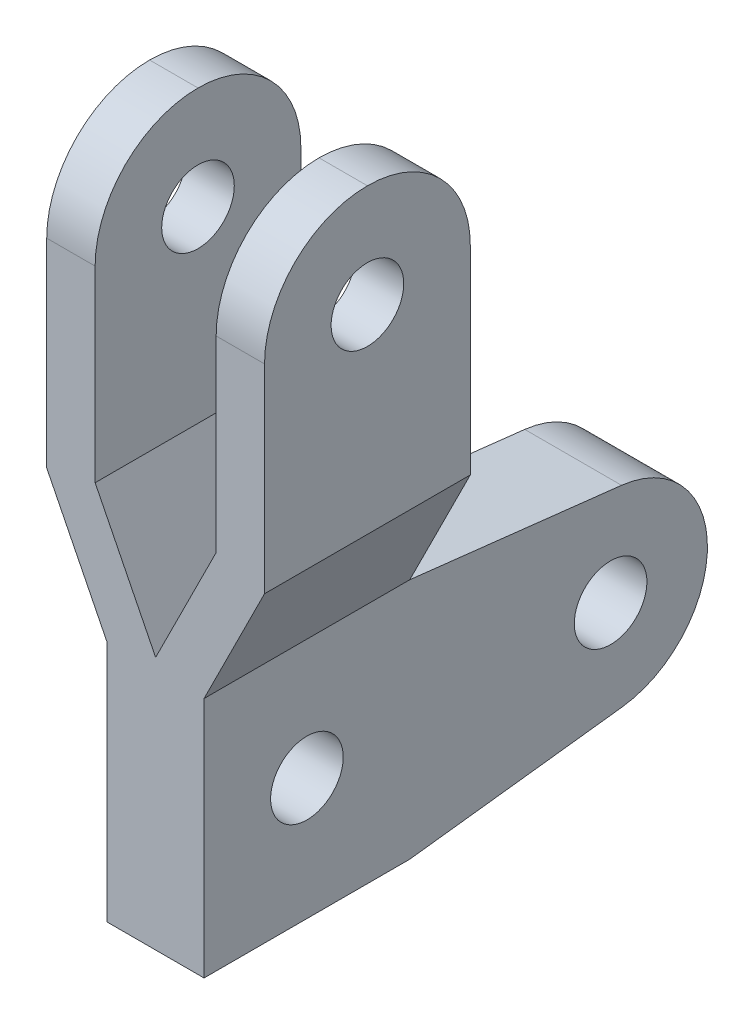
from build123d import *

# Parameters (mm, degrees)
BASE_EXTRUDE_DEPTH  = 10.795
SKETCH2_R           = 1.905
CUT_EXTRUDE1_DEPTH  = 36.062279171
FILLET1_R           = 5.3975
SKETCH3_R           = 1.905
CUT_EXTRUDE2_DEPTH  = 35.159384445
BOSS_EXTRUDE1_START = -5.08
SKETCH4_R           = 1.905
BOSS_EXTRUDE1_DEPTH = 5.08


with BuildPart() as part:
    # Sketch1 → Base-Extrude (new body)
    with BuildSketch(Plane.XY):
        Polygon((-3.175, 3.549757914), (-5.715, 3.549757914), (-5.715, -12.289854749), (-2.54, -18.639854749), (-2.54, -31.339854749), (2.54, -31.339854749), (2.54, -18.639854749), (5.715, -12.289854749), (5.715, 3.549757914), (3.175, 3.549757914), (3.175, -11.690242086), (0, -18.040242086), (-3.175, -11.690242086), align=None)
    extrude(amount=BASE_EXTRUDE_DEPTH)

    # Sketch2 → Cut-Extrude1 (cut, through all)
    with BuildSketch(Plane(origin=(5.715, 0, 0), x_dir=(0, 0, -1), z_dir=(1, 0, 0))):
        with Locations(Location((-5.3975, -1.847742086, 0), (0, 0, 90))):
            Circle(SKETCH2_R)
    extrude(amount=-CUT_EXTRUDE1_DEPTH, mode=Mode.SUBTRACT)

    # Fillet1
    # the kernel refuses this fillet: 5.3975 mm, written as the material it takes off along each edge
    with BuildSketch(Plane(origin=(19.20875, 3.549757914, 0), x_dir=(0, -1, 0), z_dir=(-1, 0, 0)), Plane(origin=(10.31875, 3.549757914, 10.795), x_dir=(0, 0, -1), z_dir=(-1, 0, 0))) as fillet1_piece_1:
        with BuildLine():
            CenterArc((FILLET1_R, FILLET1_R), FILLET1_R, 180, 90)
            Line((0, FILLET1_R), (0, 0))
            Line((0, 0), (FILLET1_R, 0))
        make_face()
    extrude(amount=29.5275, mode=Mode.SUBTRACT)
    with BuildSketch(Plane(origin=(10.31875, 3.549757914, 0), x_dir=(0, 0, 1), z_dir=(-1, 0, 0)), Plane(origin=(19.20875, 3.549757914, 10.795), x_dir=(0, -1, 0), z_dir=(-1, 0, 0))) as fillet1_piece_2:
        with BuildLine():
            CenterArc((FILLET1_R, -FILLET1_R), FILLET1_R, 90, 90)
            Line((0, -FILLET1_R), (0, 0))
            Line((0, 0), (FILLET1_R, 0))
        make_face()
    extrude(amount=29.5275, mode=Mode.SUBTRACT)

    # Sketch3 → Cut-Extrude2 (cut, through all)
    with BuildSketch(Plane(origin=(2.54, 0, 0), x_dir=(0, 0, -1), z_dir=(1, 0, 0))):
        with Locations(Location((-5.3975, -24.951582086, 0), (0, 0, 90))):
            Circle(SKETCH3_R)
    extrude(amount=-CUT_EXTRUDE2_DEPTH, mode=Mode.SUBTRACT)

    # Sketch4 → Boss-Extrude1 (add)
    with BuildSketch(Plane(origin=(2.54, 0, 0), x_dir=(0, 0, -1), z_dir=(1, 0, 0)).offset(BOSS_EXTRUDE1_START)):
        with BuildLine():
            Line((0, -31.339854749), (11.146934896, -29.995009323))
            ThreePointArc((11.146934896, -29.995009323), (15.618430773, -24.934350077), (11.112705191, -19.904142887))
            Line((11.112705191, -19.904142887), (0, -18.639854749))
            Line((0, -18.639854749), (0, -31.339854749))
        make_face()
        with Locations(Location((10.53846, -24.951582086, 0), (0, 0, 90))):
            Circle(SKETCH4_R, mode=Mode.SUBTRACT)
    extrude(amount=BOSS_EXTRUDE1_DEPTH)


solid = part.part
